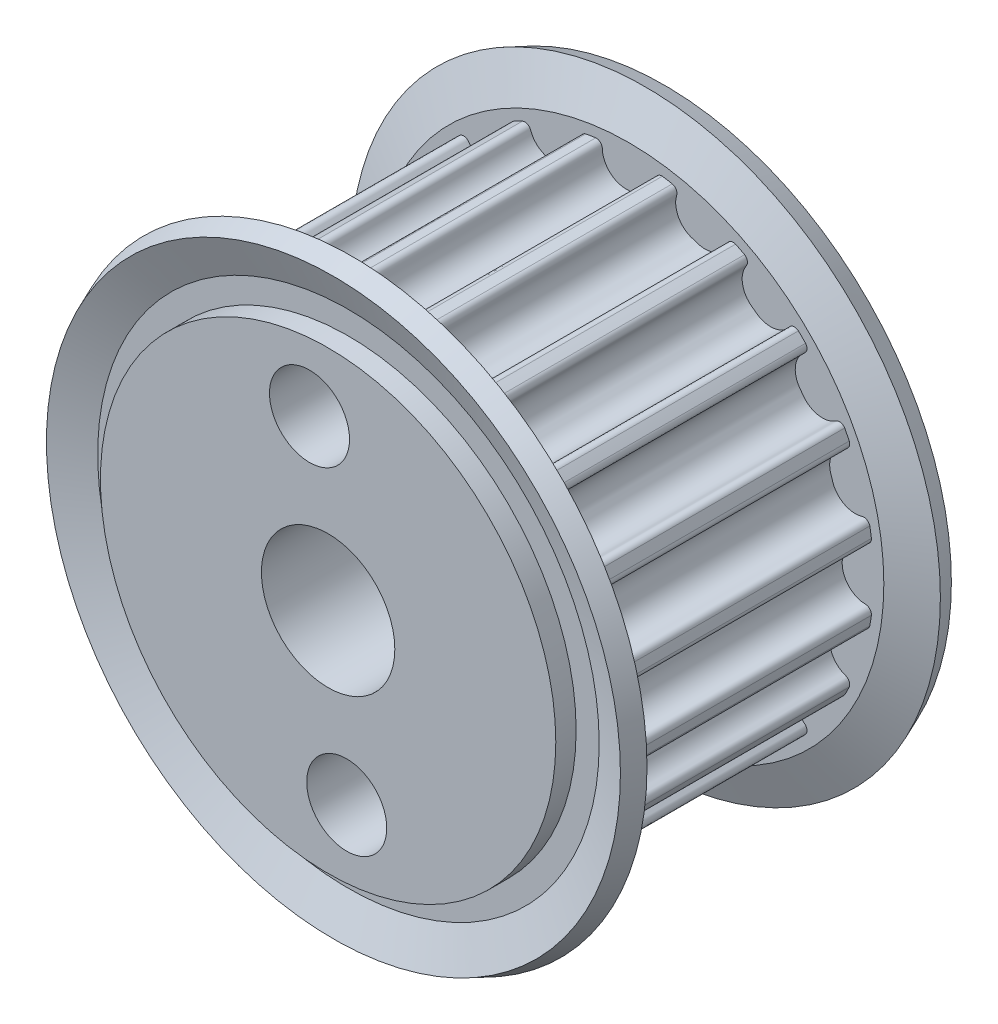
from build123d import *

# Parameters (mm, degrees)
TOOTHEXTRUDECUTGEARBELT01_DEPTH = 4.876799927
PATTERNGEARBELT01_COUNT         = 20
BOREREVOLVESKETCH_W             = 12.801599808
BOREREVOLVESKETCH_H             = 2.5
SKETCH_1_R                      = 1.5
CUT_EXTRUDE_1_DEPTH             = 13


with BuildPart() as part:
    # SketchRevolveGearBelt01 → GearBelt01 (revolve)
    with BuildSketch(Plane(origin=(0, 0, 0), x_dir=(0, 0, -1), z_dir=(1, 0, 0))):
        Polygon((6.400799904, 0), (6.400799904, 8.53261095), (5.638799915, 8.53261095), (5.638799915, 9.397039713), (6.201536555, 10.755606141), (5.497540362, 11.047210912), (4.876799927, 9.548610935), (4.876799927, 9.16761094), (-4.876799927, 9.16761094), (-4.876799927, 9.548610935), (-5.497540362, 11.047210912), (-6.201536555, 10.755606141), (-5.638799915, 9.397039713), (-5.638799915, 8.53261095), (-6.400799904, 8.53261095), (-6.400799904, 0), align=None)
    revolve(axis=Axis((0, 0, 0), (0, 0, -1)))

    # SketchToothGearBelt01 → ToothExtrudeCutGearBelt01 (cut, symmetric)
    with BuildSketch(Plane.XY):
        with BuildLine():
            ThreePointArc((9.080869201, 1.261443793), (9.168065548, 0), (9.080869201, -1.261443793))
            add(Edge.make_bspline(
                [(9.080869201, -1.261443793), (9.082662513, -1.24854463), (9.083693408, -1.228966067), (9.081733826, -1.202969887), (9.078608457, -1.183668863), (9.073849952, -1.164704306), (9.067492966, -1.146214136), (9.059583715, -1.128332821), (9.050179723, -1.111190399), (9.039349378, -1.094911538), (9.027171443, -1.079614622), (9.01373448, -1.065410906), (8.99913621, -1.052403646), (8.983482788, -1.040687583), (8.966888093, -1.030347374), (8.949472647, -1.02146025), (8.931363708, -1.014083265), (8.912690705, -1.008298333), (8.8935979, -1.004042045), (8.8349227, -0.997078433), (8.758797506, -0.9959852), (8.668115139, -0.976671733), (8.601008495, -0.957794837), (8.535621705, -0.933456971), (8.47233254, -0.904143087), (8.411536258, -0.869943409), (8.353604663, -0.831092136), (8.298894136, -0.787821511), (8.24774069, -0.740399112), (8.200458629, -0.68911583), (8.15733846, -0.634286866), (8.118645028, -0.576249048), (8.084616363, -0.515358957), (8.055460395, -0.451990704), (8.031360492, -0.386533555), (8.012448905, -0.319389892), (7.998900848, -0.250971402), (7.990579277, -0.18170154), (7.988502837, -0.116556682), (7.988958614, -0.056000917), (7.98881813, 0), (7.988958614, 0.056000917), (7.988502837, 0.116556682), (7.990579277, 0.18170154), (7.998900848, 0.250971402), (8.012448905, 0.319389892), (8.031360492, 0.386533555), (8.055460395, 0.451990704), (8.084616363, 0.515358957), (8.118645028, 0.576249048), (8.15733846, 0.634286866), (8.200458629, 0.68911583), (8.24774069, 0.740399112), (8.298894136, 0.787821511), (8.353604663, 0.831092136), (8.411536258, 0.869943409), (8.47233254, 0.904143087), (8.535621705, 0.933456971), (8.601008495, 0.957794837), (8.668115139, 0.976671733), (8.758797506, 0.9959852), (8.8349227, 0.997078433), (8.8935979, 1.004042045), (8.912690705, 1.008298333), (8.931363708, 1.014083265), (8.949472647, 1.02146025), (8.966888093, 1.030347374), (8.983482788, 1.040687583), (8.99913621, 1.052403646), (9.01373448, 1.065410906), (9.027171443, 1.079614622), (9.039349378, 1.094911538), (9.050179723, 1.111190399), (9.059583715, 1.128332821), (9.067492966, 1.146214136), (9.073849952, 1.164704306), (9.078608457, 1.183668863), (9.081733826, 1.202969887), (9.083693408, 1.228966067), (9.082662513, 1.24854463), (9.080869201, 1.261443793)],
                knots=[0, 0, 0, 0, 0.010413034, 0.015619551, 0.020826068, 0.026032585, 0.031239102, 0.03644562, 0.041652137, 0.046858654, 0.052065171, 0.057271688, 0.062478205, 0.067684722, 0.072891239, 0.078097756, 0.083304273, 0.08851079, 0.093717307, 0.098923825, 0.135739015, 0.154316842, 0.172894669, 0.191472497, 0.210050324, 0.228628151, 0.247205978, 0.265783806, 0.284361633, 0.30293946, 0.321517287, 0.340095114, 0.358672942, 0.377250769, 0.395828596, 0.414406423, 0.43298425, 0.451562078, 0.470139905, 0.485069952, 0.5, 0.514930048, 0.529860095, 0.548437922, 0.56701575, 0.585593577, 0.604171404, 0.622749231, 0.641327058, 0.659904886, 0.678482713, 0.69706054, 0.715638367, 0.734216194, 0.752794022, 0.771371849, 0.789949676, 0.808527503, 0.827105331, 0.845683158, 0.864260985, 0.901076175, 0.906282693, 0.91148921, 0.916695727, 0.921902244, 0.927108761, 0.932315278, 0.937521795, 0.942728312, 0.947934829, 0.953141346, 0.958347863, 0.96355438, 0.968760898, 0.973967415, 0.979173932, 0.984380449, 0.989586966, 1, 1, 1, 1], degree=3))
        make_face()
    toothextrudecutgearbelt01 = extrude(amount=TOOTHEXTRUDECUTGEARBELT01_DEPTH, both=True, mode=Mode.SUBTRACT)

    # PatternGearBelt01: ToothExtrudeCutGearBelt01 ×20 about axis
    patterngearbelt01_axis = Axis((0, 0, 55), (0, 0, -1))
    for i in range(1, PATTERNGEARBELT01_COUNT):
        add(toothextrudecutgearbelt01.rotate(patterngearbelt01_axis, i * 360 / PATTERNGEARBELT01_COUNT), mode=Mode.SUBTRACT)

    # BoreRevolveSketch → BoreRevolveCut (revolve, cut)
    with BuildSketch(Plane(origin=(0, 0, 0), x_dir=(0, 0, -1), z_dir=(1, 0, 0))):
        with Locations((0, 1.25)):
            Rectangle(BOREREVOLVESKETCH_W, BOREREVOLVESKETCH_H)
    revolve(axis=Axis((0, 0, 0), (0, 0, -1)), mode=Mode.SUBTRACT)

    # 草图1 → 切除-拉伸1 (cut)
    with BuildSketch(Plane.XY.offset(6.400799904)):
        with Locations((0.697390236, -5.959332753)):
            Circle(SKETCH_1_R)
        with Locations((-0.697390236, 5.959332753)):
            Circle(SKETCH_1_R)
    extrude(amount=-CUT_EXTRUDE_1_DEPTH, mode=Mode.SUBTRACT)


solid = part.part
